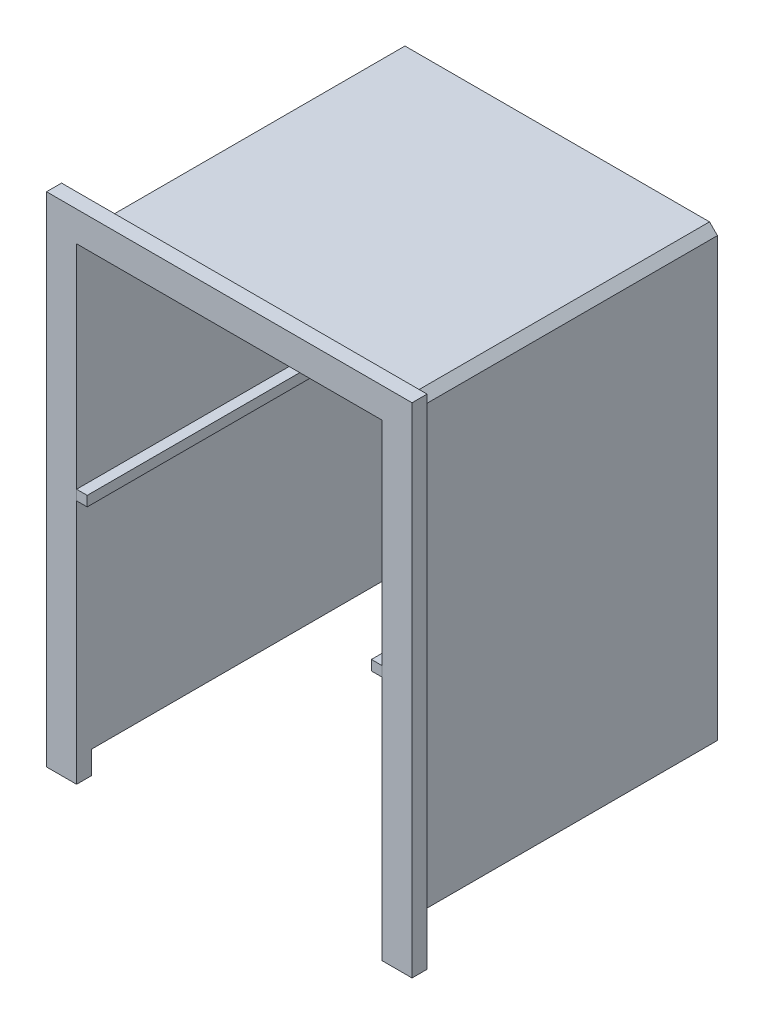
from build123d import *

# Parameters (mm, degrees)
ESQUISSE3_W                  = 128
ESQUISSE3_H                  = 181
BOSS_EXTRU_4_DEPTH           = 131
COQUE2_T                     = -3
CHANFREIN1_SIZE              = 3.17
ESQUISSE4_W                  = 146
ESQUISSE4_H                  = 199
BOSS_EXTRU_5_DEPTH           = 6
ESQUISSE5_W                  = 122
ESQUISSE5_H                  = 9.17
ENL_V_MAT_EXTRU_1_DEPTH      = 6
ESQUISSE6_W                  = 8
ESQUISSE6_H                  = 40
BOSS_EXTRU_6_DEPTH           = 40
ENL_V_MAT_EXTRU_2_DEPTH      = 26
CONG_2_R                     = 7.5
ENL_V_MAT_EXTRU_3_REACH      = 187.627
ESQUISSE8_R                  = 3
ESQUISSE9_W                  = 122
ESQUISSE9_H                  = 4
BOSS_EXTRU_7_DEPTH           = 128
COQUE3_T                     = -4.24
ESQUISSE10_W                 = 8
ESQUISSE10_H                 = 8
BOSS_EXTRU_8_DEPTH           = 20
ENL_V_MAT_EXTRU_4_DEPTH      = 230.708510944
ENL_V_MAT_EXTRU_4_DEPTH_BACK = 21
ESQUISSE12_W                 = 8
ESQUISSE12_H                 = 8
BOSS_EXTRU_9_DEPTH           = 20
ENL_V_START                  = -8
ENL_V_MAT_EXTRU_6_DEPTH      = 8


# Read off the part's stored shape, not the designer's step: Enlèv. mat.-Extru.6
with BuildPart() as part:
    # Esquisse3 → Boss.-Extru.4 (new body)
    with BuildSketch(Plane.XY):
        Rectangle(ESQUISSE3_W, ESQUISSE3_H)
    extrude(amount=-BOSS_EXTRU_4_DEPTH)

    # Coque2
    coque2_openings = [part.faces().sort_by_distance(p)[0] for p in [
        (0, 0, 0),
        (0, -90.5, -65.5),
    ]]
    offset(amount=COQUE2_T, openings=coque2_openings, kind=Kind.INTERSECTION)

    # Chanfrein1
    chanfrein1_edges = [part.edges().sort_by_distance(p)[0] for p in [
        (64, -90.5, -65.5),
        (-64, -90.5, -65.5),
        (-64, 90.5, -65.5),
        (64, 90.5, -65.5),
    ]]
    chamfer(chanfrein1_edges, length=CHANFREIN1_SIZE)

    # Esquisse4 → Boss.-Extru.5 (add)
    with BuildSketch(Plane.XY):
        Rectangle(ESQUISSE4_W, ESQUISSE4_H)
        Polygon((-64, 87.33), (-60.83, 90.5), (60.83, 90.5), (64, 87.33), (64, -87.33), (61, -90.33), (-61, -90.33), (-64, -87.33), align=None, mode=Mode.SUBTRACT)
    extrude(amount=-BOSS_EXTRU_5_DEPTH)

    # Esquisse5 → Enlèv. mat.-Extru.1 (cut)
    with BuildSketch(Plane.XY):
        with Locations((0, -94.915)):
            Rectangle(ESQUISSE5_W, ESQUISSE5_H)
    extrude(amount=-ENL_V_MAT_EXTRU_1_DEPTH, mode=Mode.SUBTRACT)

    # Esquisse6 → Boss.-Extru.6 (add)
    with BuildSketch(Plane.XY.offset(-128)):
        with Locations((9, -70.5)):
            Rectangle(ESQUISSE6_W, ESQUISSE6_H)
        with Locations((-9, -70.5)):
            Rectangle(ESQUISSE6_W, ESQUISSE6_H)
    extrude(amount=BOSS_EXTRU_6_DEPTH)

    # Esquisse7 → Enlèv. mat.-Extru.2 (cut)
    with BuildSketch(Plane(origin=(13, 0, 0), x_dir=(0, 0, -1), z_dir=(1, 0, 0))):
        Polygon((128, -50.5), (88, -65.5), (88, -50.5), align=None)
        Polygon((128, -90.5), (88, -75.5), (88, -90.5), align=None)
    extrude(amount=-ENL_V_MAT_EXTRU_2_DEPTH, mode=Mode.SUBTRACT)

    # Congé2
    # the kernel refuses this fillet: 7.5 mm, written as the material it takes off along each edge
    with BuildSketch(Plane(origin=(25.993758778, -75.5, -88), x_dir=(0, -0.3511234415883899, -0.9363291775690452), z_dir=(-1, 0, 0)), Plane(origin=(7.993758778, -75.5, -88), x_dir=(0, -0.3511234415883899, -0.9363291775690452), z_dir=(-1, 0, 0))) as cong_2_piece_1:
        with BuildLine():
            CenterArc((CONG_2_R * 0.693000468165, -CONG_2_R), CONG_2_R, 90, 69.44395478)
            Line((-CONG_2_R * 0.243328709404, -CONG_2_R * 0.648876558412), (0, 0))
            Line((0, 0), (CONG_2_R * 0.693000468165, 0))
        make_face()
    extrude(amount=33.987517556, mode=Mode.SUBTRACT)
    with BuildSketch(Plane(origin=(7.993758778, -65.5, -88), x_dir=(0, 0.3511234415883905, -0.936329177569045), z_dir=(-1, 0, 0)), Plane(origin=(25.993758778, -65.5, -88), x_dir=(0, 0.3511234415883905, -0.936329177569045), z_dir=(-1, 0, 0))) as cong_2_piece_2:
        with BuildLine():
            CenterArc((CONG_2_R * 0.693000468165, CONG_2_R), CONG_2_R, 200.55604522, 69.44395478)
            Line((-CONG_2_R * 0.243328709404, CONG_2_R * 0.648876558412), (0, 0))
            Line((0, 0), (CONG_2_R * 0.693000468165, 0))
        make_face()
    extrude(amount=33.987517556, mode=Mode.SUBTRACT)

    # Enlèv. mat.-Extru.3: up to this face of the body (flat: up to its plane)
    enl_v_mat_extru_3_end = Plane(part.part.faces().sort_by_distance((13, -70.5, -112.226918248))[0])
    # Esquisse8 → Enlèv. mat.-Extru.3 (cut, up to the picked face)
    with BuildSketch(Plane.ZY.offset(13), mode=Mode.PRIVATE) as enl_v_mat_extru_3_sk1:
        with Locations((-93.00260096, -70.5)):
            Circle(ESQUISSE8_R)
    enl_v_mat_extru_3_tool1 = split(extrude(enl_v_mat_extru_3_sk1.sketch, amount=-ENL_V_MAT_EXTRU_3_REACH, mode=Mode.PRIVATE), bisect_by=enl_v_mat_extru_3_end, keep=Keep.BOTH, mode=Mode.PRIVATE)
    add(enl_v_mat_extru_3_tool1.solids().sort_by(Axis((-13, -70.5, -93.002601), (1, 0, 0)))[0], mode=Mode.SUBTRACT)

    # Esquisse10 → Boss.-Extru.8 (add)
    with BuildSketch(Plane.XY.offset(-128)):
        with Locations((17, -70.5)):
            Rectangle(ESQUISSE10_W, ESQUISSE10_H)
    extrude(amount=BOSS_EXTRU_8_DEPTH)

    # Esquisse11 → Enlèv. mat.-Extru.4 (cut, two sides: drawn at the far end of the back side and taken through both)
    with BuildSketch(Plane.XZ.offset(74.5).offset(-ENL_V_MAT_EXTRU_4_DEPTH_BACK)):
        Polygon((21, -108), (13, -108), (21, -128), align=None)
    extrude(amount=ENL_V_MAT_EXTRU_4_DEPTH + ENL_V_MAT_EXTRU_4_DEPTH_BACK, mode=Mode.SUBTRACT)

    # Esquisse12 → Boss.-Extru.9 (add)
    with BuildSketch(Plane.XY.offset(-128)):
        with Locations((-17, -70.5)):
            Rectangle(ESQUISSE12_W, ESQUISSE12_H)
    extrude(amount=BOSS_EXTRU_9_DEPTH)

    # Enlèv. mat.-Extru.6 outline → Enlèv. mat.-Extru.6 (cut)
    with BuildSketch(Plane.XZ.offset(74.5).offset(ENL_V_START)):
        Polygon((-21, -108), (-21, -128), (-13, -108), align=None)
    extrude(amount=ENL_V_MAT_EXTRU_6_DEPTH, mode=Mode.SUBTRACT)


with BuildPart() as body_2:
    # Esquisse9 → Boss.-Extru.7 (new body)
    with BuildSketch(Plane.XY.offset(-128)):
        with Locations((0, 0.585)):
            Rectangle(ESQUISSE9_W, ESQUISSE9_H)
    extrude(amount=BOSS_EXTRU_7_DEPTH)

    # Coque3
    coque3_openings = [body_2.faces().sort_by_distance(p)[0] for p in [
        (0, 0.585, 0),
        (0, 2.585, -64),
        (0, -1.415, -64),
    ]]
    offset(amount=COQUE3_T, openings=coque3_openings, kind=Kind.INTERSECTION)


solid = Compound([part.part, body_2.part])
